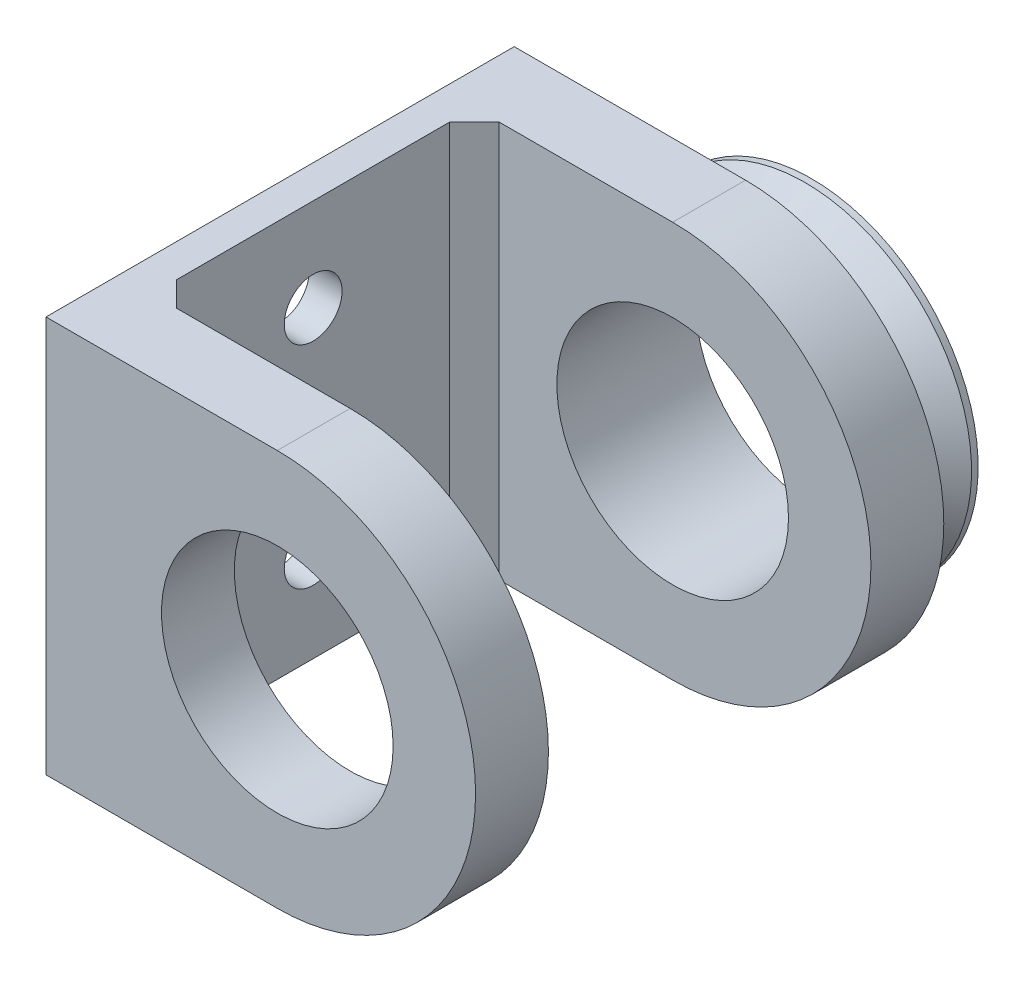
from build123d import *

# Parameters (mm, degrees)
SKETCH4_R           = 11.127
BOSS_EXTRUDE1_DEPTH = 7
SKETCH6_W           = 3.175
SKETCH6_H           = 38.1
BOSS_EXTRUDE2_DEPTH = 15.494
CHAMFER1_SIZE       = 2.38
SKETCH8_R           = 2.778125
CUT_EXTRUDE2_DEPTH  = 58.075394383
SKETCH9_R           = 16.002
SKETCH9_R_2         = 11.127
BOSS_EXTRUDE3_DEPTH = 3.175
CHAMFER2_SIZE       = 2.54
CHAMFER3_SIZE       = 2.032
CHAMFER3_SIZE2      = 0.544472759


with BuildPart() as part:
    # Sketch4 → Boss-Extrude1 (new body)
    with BuildSketch(Plane.XY):
        with BuildLine():
            Line((-19.05, 19.05), (0, 19.05))
            ThreePointArc((0, 19.05), (19.05, 0), (0, -19.05))
            Line((0, -19.05), (-19.05, -19.05))
            Line((-19.05, -19.05), (-22.225, -19.05))
            Line((-22.225, -19.05), (-22.225, 19.05))
            Line((-22.225, 19.05), (-19.05, 19.05))
        make_face()
        Circle(SKETCH4_R, mode=Mode.SUBTRACT)
    extrude(amount=-BOSS_EXTRUDE1_DEPTH)

    # Sketch6 → Boss-Extrude2 (add)
    with BuildSketch(Plane.XY):
        with Locations((-20.6375, 0)):
            Rectangle(SKETCH6_W, SKETCH6_H)
    extrude(amount=BOSS_EXTRUDE2_DEPTH)

    # Chamfer1
    chamfer1_edges = [part.edges().sort_by_distance(p)[0] for p in [
        (-19.05, 0, 0),
    ]]
    chamfer(chamfer1_edges, length=CHAMFER1_SIZE)

    # Mirror1: part across plane


with BuildPart() as part_1:
    add(part.part)
    add(part.part.mirror(Plane(origin=(0, 0, 15.494), x_dir=(1, 0, 0), z_dir=(0, 0, -1))))

    # Sketch8 → Cut-Extrude2 (cut, through all)
    with BuildSketch(Plane(origin=(-19.05, 0, 0), x_dir=(0, 0, -1), z_dir=(1, 0, 0))):
        with Locations((-15.494, 10.16)):
            Circle(SKETCH8_R)
        with Locations((-15.494, -10.16)):
            Circle(SKETCH8_R)
    extrude(amount=-CUT_EXTRUDE2_DEPTH, mode=Mode.SUBTRACT)


with BuildPart() as body_2:
    # Sketch9 → Boss-Extrude3 (new body)
    with BuildSketch(Plane(origin=(0, 0, -7), x_dir=(-1, 0, 0), z_dir=(0, 0, -1))):
        Circle(SKETCH9_R)
        Circle(SKETCH9_R_2, mode=Mode.SUBTRACT)
    extrude(amount=BOSS_EXTRUDE3_DEPTH)

    # Chamfer2
    chamfer2_edges = [body_2.edges().sort_by_distance(p)[0] for p in [
        (16.002, 0, -10.175),
    ]]
    chamfer(chamfer2_edges, length=CHAMFER2_SIZE)

    # Mirror2: body 2 across plane


with BuildPart() as body_2_1:
    add(body_2.part)
    add(body_2.part.mirror(Plane(origin=(0, 0, -10.175), x_dir=(1, 0, 0), z_dir=(0, 0, -1))))


with BuildPart() as part_2:
    add(part_1.part)

    # Combine1: union body 2
    add(body_2_1.part)

    # Chamfer3
    chamfer3_edges = [part_2.edges().sort_by_distance(p)[0] for p in [
        (16.002, 0, -7),
    ]]
    chamfer3_side = [part_2.faces().sort_by_distance(p)[0] for p in [
        (-11.1125, 18.488285159, -7),
    ]]
    chamfer(chamfer3_edges, length=CHAMFER3_SIZE, length2=CHAMFER3_SIZE2, reference=chamfer3_side[0])


solid = part_2.part
